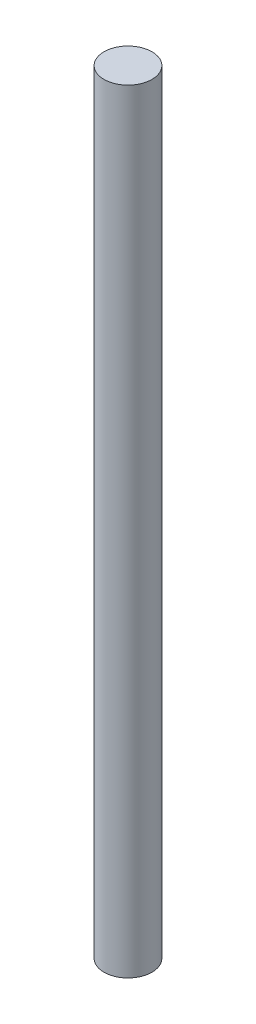
from build123d import *

# Parameters (mm, degrees)
SKETCH_1_R      = 1.55
EXTRUDE_1_DEPTH = 50


with BuildPart() as part:
    # 草图1 → 凸台-拉伸1 (new body)
    with BuildSketch(Plane(origin=(0, 0, 0), x_dir=(1, 0, 0), z_dir=(0, 1, 0))):
        Circle(SKETCH_1_R)
    extrude(amount=EXTRUDE_1_DEPTH)


solid = part.part
